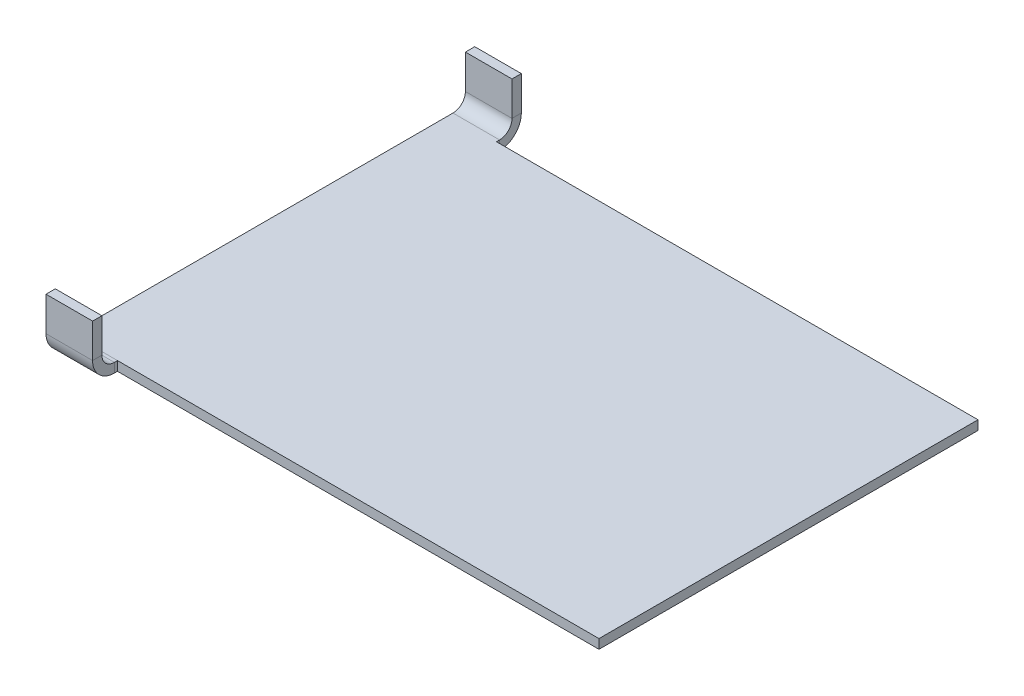
from build123d import *

# Parameters (mm, degrees)
BRIDA_BASE1_DEPTH       = 15
CROQUIS6_W              = 170
CROQUIS6_H              = 122
SALIENTE_EXTRUIR1_DEPTH = 3
BRIDA_BASE2_DEPTH       = 15


# Sheet-metal steps are written as plain solids
with BuildPart() as part:
    # Croquis1 → Brida base1 (new body)
    with BuildSketch(Plane(origin=(0, 0, 0), x_dir=(0, 0, -1), z_dir=(1, 0, 0))):
        with BuildLine():
            Line((0, 0), (1, 0))
            ThreePointArc((1, 0), (3.828427125, 1.171572875), (5, 4))
            Line((5, 4), (5, 15))
            Line((5, 15), (8, 15))
            Line((8, 15), (8, 4))
            ThreePointArc((8, 4), (5.949747468, -0.949747468), (1, -3))
            Line((1, -3), (0, -3))
            Line((0, -3), (0, 0))
        make_face()
    extrude(amount=BRIDA_BASE1_DEPTH)

    # Croquis6 → Saliente-Extruir1 (add)
    with BuildSketch(Plane(origin=(0, 0, 0), x_dir=(1, 0, 0), z_dir=(0, 1, 0))):
        with Locations((85, -61)):
            Rectangle(CROQUIS6_W, CROQUIS6_H)
    extrude(amount=-SALIENTE_EXTRUIR1_DEPTH)


with BuildPart() as body_2:
    # Croquis7 → Brida base2 (new body)
    with BuildSketch(Plane.ZY):
        with BuildLine():
            Line((122, 0), (123, 0))
            ThreePointArc((123, 0), (125.828427125, 1.171572875), (127, 4))
            Line((127, 4), (127, 15))
            Line((127, 15), (130, 15))
            Line((130, 15), (130, 4))
            ThreePointArc((130, 4), (127.949747468, -0.949747468), (123, -3))
            Line((123, -3), (122, -3))
            Line((122, -3), (122, 0))
        make_face()
    extrude(amount=-BRIDA_BASE2_DEPTH)


solid = Compound([part.part, body_2.part])
